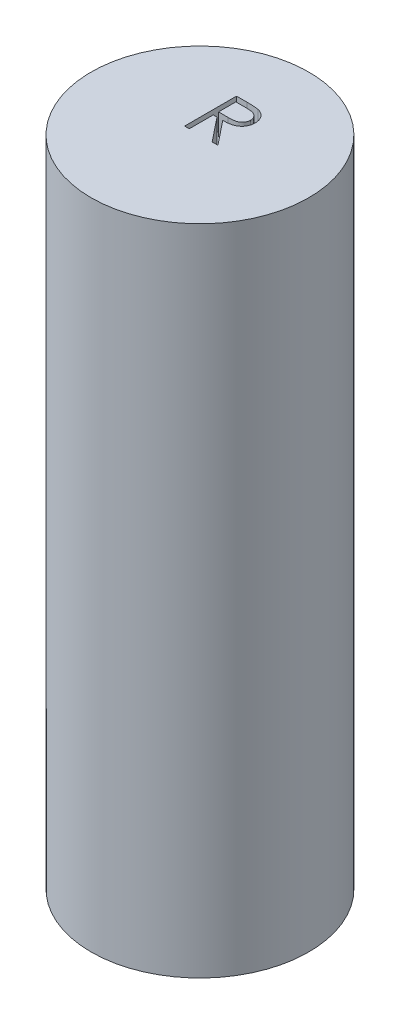
from build123d import *

# Parameters (mm, degrees)
SKETCH1_R           = 10
BOSS_EXTRUDE1_DEPTH = 4
SKETCH2_R           = 10
SKETCH2_R_2         = 8
SKETCH2_R_3         = 1.5
BOSS_EXTRUDE2_DEPTH = 52
SKETCH3_R           = 10
BOSS_EXTRUDE3_DEPTH = 4
CUT_EXTRUDE1_DEPTH  = 2


with BuildPart() as part:
    # Sketch1 → Boss-Extrude1 (new body)
    with BuildSketch(Plane(origin=(0, 0, 0), x_dir=(1, 0, 0), z_dir=(0, 1, 0))):
        Circle(SKETCH1_R)
    extrude(amount=BOSS_EXTRUDE1_DEPTH)

    # Sketch2 → Boss-Extrude2 (add)
    # profile 1 of 2: a face of its own
    with BuildSketch(Plane(origin=(0, 4, 0), x_dir=(1, 0, 0), z_dir=(0, 1, 0))):
        Circle(SKETCH2_R)
        Circle(SKETCH2_R_2, mode=Mode.SUBTRACT)
    # profile 2 of 2: a face of its own
    with BuildSketch(Plane(origin=(0, 4, 0), x_dir=(1, 0, 0), z_dir=(0, 1, 0))):
        Circle(SKETCH2_R_3)
    extrude(amount=BOSS_EXTRUDE2_DEPTH)

    # Sketch3 → Boss-Extrude3 (add)
    with BuildSketch(Plane(origin=(0, 56, 0), x_dir=(1, 0, 0), z_dir=(0, 1, 0))):
        Circle(SKETCH3_R)
    extrude(amount=BOSS_EXTRUDE3_DEPTH)

    # Sketch4 → Cut-Extrude1 (cut)
    with BuildSketch(Plane(origin=(0, 60, 0), x_dir=(1, 0, 0), z_dir=(0, 1, 0))):
        with BuildLine():
            Line((-1.404326923, 4.7625), (-0.451254507, 4.7625))
            add(Edge.make_bspline(
                [(-0.451254507, 4.7625), (-0.387653186, 4.762288292), (-0.265531604, 4.761881789), (-0.090580118, 4.759615162), (0.068388182, 4.753118628), (0.211290178, 4.747528019), (0.338123247, 4.737333628), (0.449276311, 4.727590033), (0.544237428, 4.714835159), (0.601721961, 4.702989565), (0.627749399, 4.697626202)],
                knots=[0, 0, 0, 0, 1.410062039, 2.707475311, 3.878576406, 4.937260626, 5.877586885, 6.699081471, 7.410979367, 8, 8, 8, 8], degree=3))
            add(Edge.make_bspline(
                [(0.627749399, 4.697626202), (0.662592698, 4.689017282), (0.731535995, 4.671983094), (0.830800192, 4.635979137), (0.925389325, 4.594314576), (1.014910479, 4.545378228), (1.098915252, 4.488806831), (1.178269811, 4.425576993), (1.253334245, 4.356034688), (1.32107282, 4.278426565), (1.384943458, 4.197006171), (1.438812268, 4.108962845), (1.485248657, 4.016894838), (1.522219967, 3.919865816), (1.551989638, 3.818816762), (1.572980343, 3.712832364), (1.585568566, 3.602395465), (1.586850162, 3.527069168), (1.5875, 3.4888747)],
                knots=[0, 0, 0, 0, 1.027469482, 2.033020251, 3.019912614, 3.986113645, 4.951240523, 5.91722682, 6.890402269, 7.87763091, 8.8651537, 9.85103654, 10.82876324, 11.815024772, 12.821070561, 13.842952187, 14.906261191, 16, 16, 16, 16], degree=3))
            add(Edge.make_bspline(
                [(1.5875, 3.4888747), (1.585501113, 3.425417646), (1.581600768, 3.3015965), (1.545235537, 3.121899372), (1.485668201, 2.954273912), (1.40358544, 2.79893118), (1.299056082, 2.658899194), (1.17342842, 2.535903611), (1.02663237, 2.432979301), (0.889976765, 2.36160602), (0.769262086, 2.31589567), (0.669884614, 2.283733338), (0.56148062, 2.258884021), (0.445088747, 2.236622556), (0.32022463, 2.219815429), (0.187187541, 2.207505599), (0.045882599, 2.199812054), (-0.051189492, 2.198666326), (-0.101126803, 2.198076923)],
                knots=[0, 0, 0, 0, 1.260483769, 2.459530307, 3.627416485, 4.787058657, 5.939039949, 7.08810263, 8.267026773, 9.491475466, 10.141966685, 10.831826277, 11.566392101, 12.351337768, 13.187381173, 14.07005841, 15.007169909, 16, 16, 16, 16], degree=3))
            Line((-0.101126803, 2.198076923), (1.648557692, 0))
            Line((1.648557692, 0), (1.120027043, 0))
            Line((1.120027043, 0), (-0.629657452, 2.198076923))
            Line((-0.629657452, 2.198076923), (-0.976923077, 2.198076923))
            Line((-0.976923077, 2.198076923), (-0.976923077, 0))
            Line((-0.976923077, 0), (-1.404326923, 0))
            Line((-1.404326923, 0), (-1.404326923, 4.7625))
        make_face()
        with BuildLine():
            Line((-0.976923077, 4.274038462), (-0.976923077, 2.686538462))
            Line((-0.976923077, 2.686538462), (-0.104942909, 2.679860276))
            add(Edge.make_bspline(
                [(-0.104942909, 2.679860276), (-0.064230284, 2.679842265), (0.014682377, 2.679807354), (0.128847211, 2.685241742), (0.235146363, 2.691423901), (0.333173243, 2.700879974), (0.422971644, 2.713066629), (0.504496681, 2.72831069), (0.577881434, 2.746070818), (0.663468374, 2.773559459), (0.759040225, 2.817110505), (0.862905533, 2.880472844), (0.951355143, 2.960168681), (1.026082663, 3.05130042), (1.08613021, 3.151498316), (1.128464827, 3.259561304), (1.15532865, 3.372761299), (1.158497136, 3.450564368), (1.160096154, 3.489828726)],
                knots=[0, 0, 0, 0, 1.146690395, 2.22261258, 3.21895312, 4.145990853, 4.996080663, 5.770904154, 6.481378293, 7.121626537, 8.300444488, 9.431385265, 10.535395872, 11.636531494, 12.74115979, 13.810798291, 14.895190096, 16, 16, 16, 16], degree=3))
            add(Edge.make_bspline(
                [(1.160096154, 3.489828726), (1.158460411, 3.528128171), (1.155218964, 3.604023696), (1.128754747, 3.715134059), (1.084001696, 3.820000159), (1.023691794, 3.918195405), (0.950214372, 4.007329996), (0.86405692, 4.083594157), (0.767575208, 4.146526465), (0.677399041, 4.186741532), (0.596798202, 4.211397476), (0.526817129, 4.228748166), (0.447744011, 4.242687962), (0.359194905, 4.253856787), (0.261547829, 4.263456551), (0.15430905, 4.269922364), (0.038190074, 4.273751229), (-0.042292, 4.273940489), (-0.083954327, 4.274038462)],
                knots=[0, 0, 0, 0, 1.101028733, 2.181837193, 3.264309656, 4.369019818, 5.486613113, 6.575447106, 7.666700264, 8.788928104, 9.402425223, 10.0903467, 10.862060571, 11.710948788, 12.657782767, 13.684531032, 14.801375019, 16, 16, 16, 16], degree=3))
            Line((-0.083954327, 4.274038462), (-0.976923077, 4.274038462))
        make_face(mode=Mode.SUBTRACT)
    extrude(amount=-CUT_EXTRUDE1_DEPTH, mode=Mode.SUBTRACT)


solid = part.part
